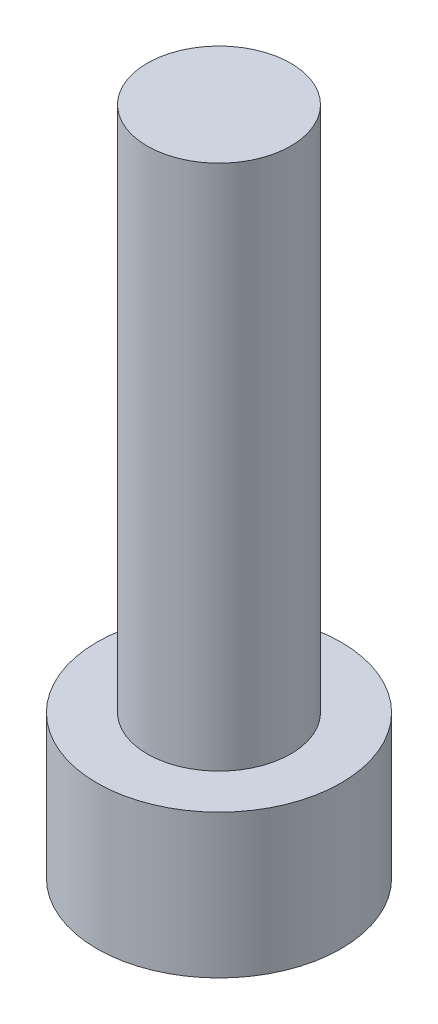
from build123d import *

# Parameters (mm, degrees)
SKETCH_1_R          = 5.1
EXTRUDE_1_DEPTH     = 6
SKETCH_2_R          = 3
EXTRUDE_2_DEPTH     = 22
CUT_EXTRUDE_1_DEPTH = 3


with BuildPart() as part:
    # 草图1 → 凸台-拉伸1 (new body)
    with BuildSketch(Plane(origin=(0, 0, 0), x_dir=(1, 0, 0), z_dir=(0, 1, 0))):
        Circle(SKETCH_1_R)
    extrude(amount=EXTRUDE_1_DEPTH)

    # 草图2 → 凸台-拉伸2 (add)
    with BuildSketch(Plane(origin=(0, 6, 0), x_dir=(1, 0, 0), z_dir=(0, 1, 0))):
        Circle(SKETCH_2_R)
    extrude(amount=EXTRUDE_2_DEPTH)

    # 草图3 → 切除-拉伸1 (cut)
    with BuildSketch(Plane.XZ):
        Polygon((2.357121757, -1.666526435), (2.621815107, 1.208064104), (0.26469335, 2.874590538), (-2.357121757, 1.666526435), (-2.621815107, -1.208064104), (-0.26469335, -2.874590538), align=None)
    extrude(amount=-CUT_EXTRUDE_1_DEPTH, mode=Mode.SUBTRACT)


solid = part.part
